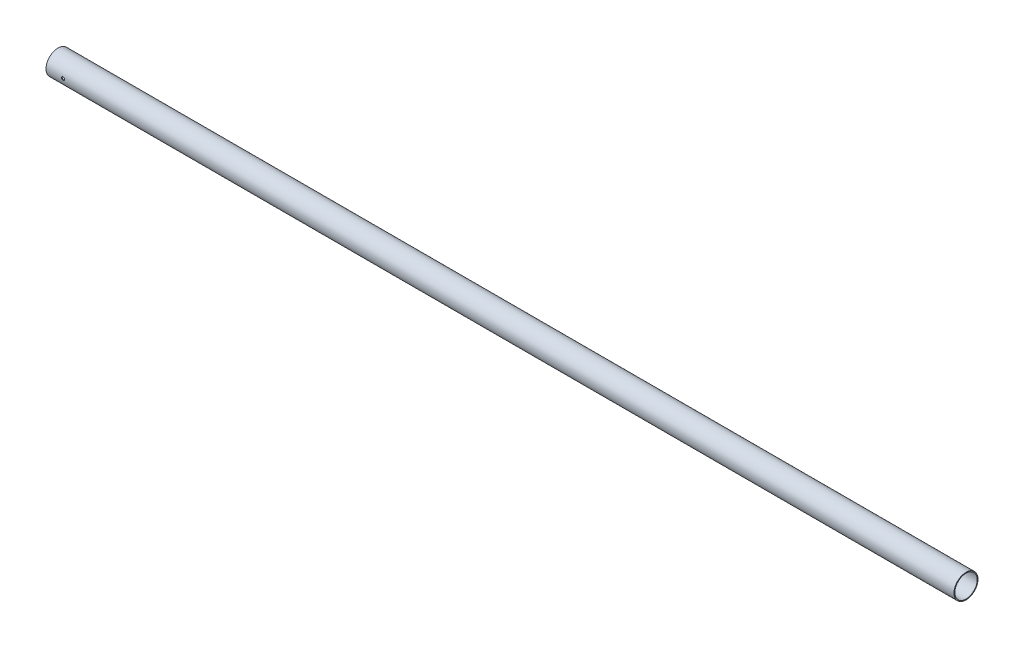
from build123d import *

# Parameters (mm, degrees)
SKETCH1_R               = 12.7
SKETCH1_R_2             = 11.811
BOSS_EXTRUDE1_DEPTH     = 960.836
CUT_EXTRUDE1_DEPTH      = 962.003849574
CUT_EXTRUDE1_DEPTH_BACK = 962.003849574
SKETCH2_R               = 1.7


with BuildPart() as part:
    # Sketch1 → Boss-Extrude1 (new body)
    with BuildSketch(Plane(origin=(0, 0, 0), x_dir=(0, 0, -1), z_dir=(1, 0, 0))):
        Circle(SKETCH1_R)
        Circle(SKETCH1_R_2, mode=Mode.SUBTRACT)
    extrude(amount=BOSS_EXTRUDE1_DEPTH)

    # Sketch2 → Cut-Extrude1 (cut, two sides: drawn at the far end of the back side and taken through both)
    with BuildSketch(Plane.XY.offset(-CUT_EXTRUDE1_DEPTH_BACK)):
        with Locations((18, 0)):
            Circle(SKETCH2_R)
    extrude(amount=CUT_EXTRUDE1_DEPTH + CUT_EXTRUDE1_DEPTH_BACK, mode=Mode.SUBTRACT)


solid = part.part
